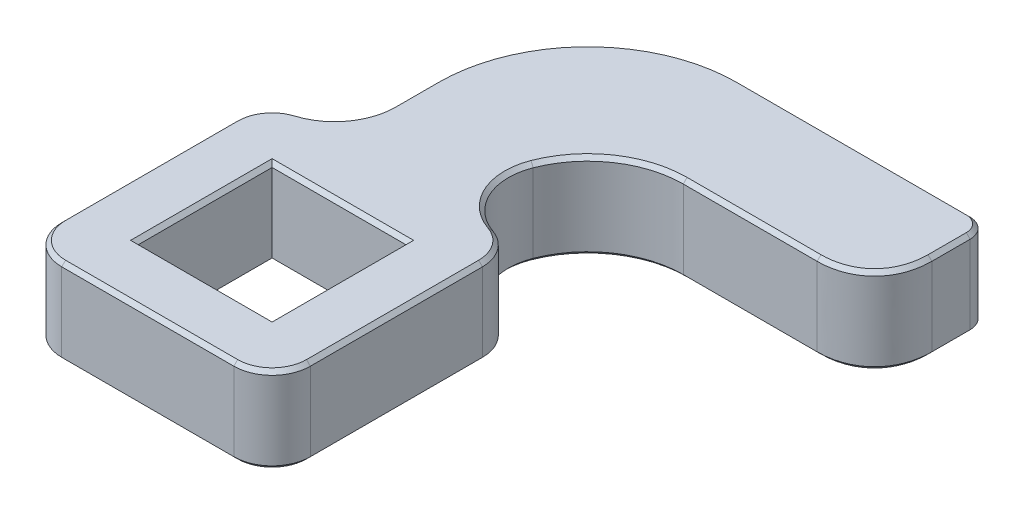
from build123d import *

# Parameters (mm, degrees)
SKETCH_1_W      = 7
SKETCH_1_H      = 7
EXTRUDE_1_DEPTH = 4.5
SKETCH_4_W      = 6
SKETCH_4_H      = 4.5
EXTRUDE_4_DEPTH = 15
FILLET_1_SIZE   = 3
FILLET_3_R      = 5
FILLET_4_R      = 8
FILLET_5_R      = 2
FILLET_6_R      = 3
FILLET_7_R      = 1
CHAMFER_3_SIZE  = 0.2


with BuildPart() as part:
    # 草图1 → 凸台-拉伸1 (new body)
    with BuildSketch(Plane(origin=(0, 0, 0), x_dir=(1, 0, 0), z_dir=(0, 1, 0))):
        Polygon((9.5, 13), (13, 13), (13, 0), (0, 0), (0, 13), (3.5, 13), (3.5, 26), (9.5, 26), align=None)
        with Locations((6.5, 6.5)):
            Rectangle(SKETCH_1_W, SKETCH_1_H, mode=Mode.SUBTRACT)
    extrude(amount=EXTRUDE_1_DEPTH)

    # 草图4 → 凸台-拉伸4 (add)
    with BuildSketch(Plane(origin=(9.5, 0, 0), x_dir=(0, 0, -1), z_dir=(1, 0, 0))):
        with Locations((23, 2.25)):
            Rectangle(SKETCH_4_W, SKETCH_4_H)
    extrude(amount=EXTRUDE_4_DEPTH)

    # 圆角1
    # a fillet whose section is not a circle: 3 mm, written as the material it takes off along each edge
    with BuildSketch(Plane(origin=(24.5, 12, -20), x_dir=(-1, 0, 0), z_dir=(0, -1, 0))) as fillet_1_piece_1:
        with BuildLine():
            Bezier((FILLET_1_SIZE, 0), (0, 0), (0, FILLET_1_SIZE), weights=[1, 0.818181818, 1])
            Line((0, FILLET_1_SIZE), (0, 0))
            Line((0, 0), (FILLET_1_SIZE, 0))
        make_face()
    extrude(amount=19.5, mode=Mode.SUBTRACT)

    # 圆角3
    fillet_3_edges = [part.edges().sort_by_distance(p)[0] for p in [
        (9.5, 2.25, -20),
    ]]
    fillet(fillet_3_edges, radius=FILLET_3_R)

    # 圆角4
    fillet_4_edges = [part.edges().sort_by_distance(p)[0] for p in [
        (3.5, 2.25, -26),
    ]]
    fillet(fillet_4_edges, radius=FILLET_4_R)

    # 圆角5
    fillet_5_edges = [part.edges().sort_by_distance(p)[0] for p in [
        (0, 2.25, -13),
        (13, 2.25, -13),
        (13, 2.25, 0),
        (0, 2.25, 0),
    ]]
    fillet(fillet_5_edges, radius=FILLET_5_R)

    # 圆角6
    fillet_6_edges = [part.edges().sort_by_distance(p)[0] for p in [
        (9.5, 2.25, -13),
        (3.5, 2.25, -13),
    ]]
    fillet(fillet_6_edges, radius=FILLET_6_R)

    # 圆角7
    fillet_7_edges = [part.edges().sort_by_distance(p)[0] for p in [
        (24.5, 2.25, -26),
    ]]
    fillet(fillet_7_edges, radius=FILLET_7_R)

    # 倒角3
    chamfer_3_edges = [part.edges().sort_by_distance(p)[0] for p in [
        (18, 4.5, -20),
        (11.676872614, 4.5, -19.126736212),
        (11.676872614, 0, -19.126736212),
        (12.629227016, 0, -12.160008331),
        (12.629227016, 4.5, -12.160008331),
        (13, 4.5, -6.5),
        (13, 0, -6.5),
        (12.414213562, 4.5, -0.585786438),
        (12.414213562, 0, -0.585786438),
        (6.5, 0, 0),
        (6.5, 4.5, 0),
        (0.585786438, 4.5, -0.585786438),
        (0.585786438, 0, -0.585786438),
        (0, 0, -6.5),
        (0, 4.5, -6.5),
        (0.38754845, 4.5, -12.183215957),
        (0.38754845, 0, -12.183215957),
        (3.5, 0, -16.884848004),
        (3.5, 4.5, -16.884848004),
        (5.843145751, 4.5, -23.656854249),
        (5.843145751, 0, -23.656854249),
        (17.5, 4.5, -26),
        (17.5, 0, -26),
        (24.207106781, 0, -25.707106781),
        (24.207106781, 4.5, -25.707106781),
        (23.675, 4.5, -20.825),
        (23.675, 0, -20.825),
        (18, 0, -20),
        (10, 0, -6.5),
        (10, 4.5, -6.5),
        (6.5, 0, -3),
        (6.5, 4.5, -3),
        (3, 0, -6.5),
        (3, 4.5, -6.5),
        (6.5, 0, -10),
        (6.5, 4.5, -10),
        (2.918677324, 4.5, -13.994872072),
        (2.918677324, 0, -13.994872072),
        (9.913215245, 4.5, -14.465146968),
        (9.913215245, 0, -14.465146968),
        (24.5, 0, -24),
        (24.5, 4.5, -24),
    ]]
    chamfer(chamfer_3_edges, length=CHAMFER_3_SIZE)


solid = part.part
